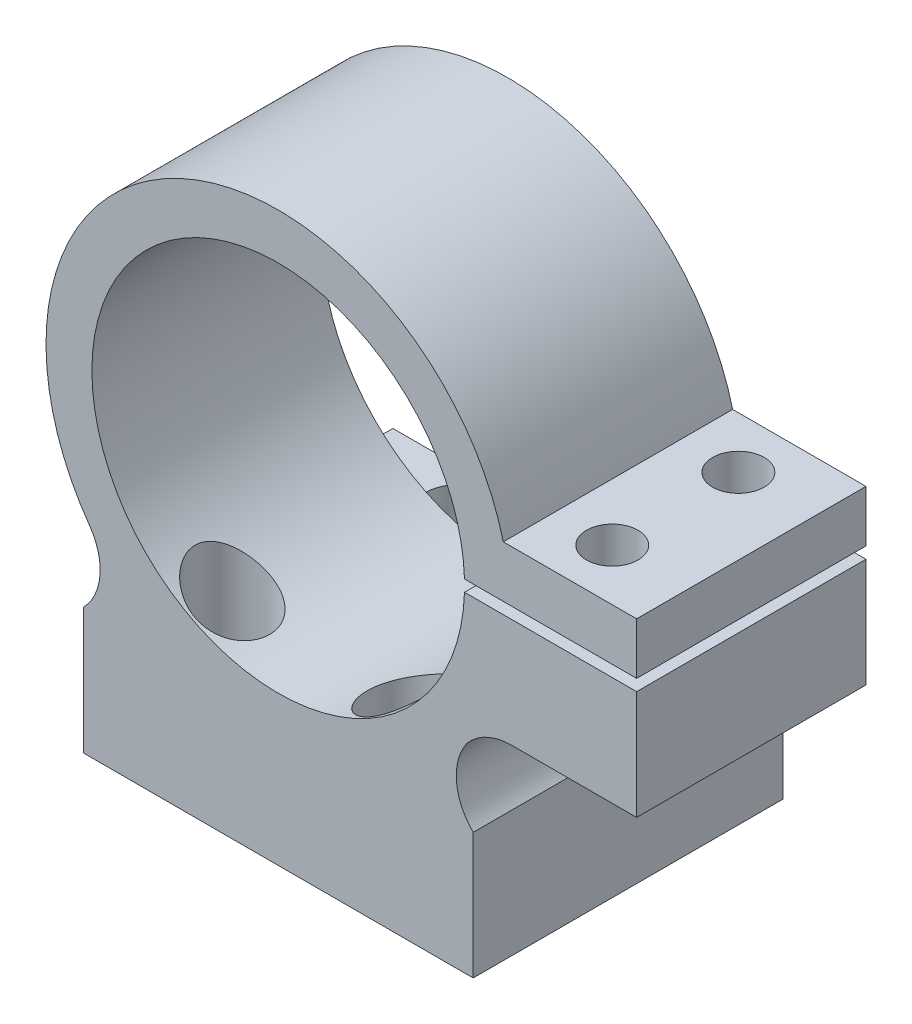
from build123d import *

# Parameters (mm, degrees)
SKETCH1_W                     = 34
SKETCH1_H                     = 27
BOSS_EXTRUDE1_DEPTH           = 11
SKETCH2_R                     = 20.25
SKETCH2_R_2                   = 16.25
MOTOR_CLAMP_BAND_DEPTH        = 20
FILLET4_R                     = 5
SKETCH7_W                     = 15
SKETCH7_H                     = 15
BOSS_EXTRUDE3_DEPTH           = 20
FILLET5_R                     = 5
CBORE_FOR_M3_SHCS1_AT_2_COUNT = 2
CBORE_FOR_M3_SHCS1_AT_2_PITCH = 15
CBORE_FOR_M3_SHCS1_AT_3_COUNT = 2
CBORE_FOR_M3_SHCS1_AT_3_PITCH = 25
CBORE_FOR_M3_SHCS1_AT_4_COUNT = 2
CBORE_FOR_M3_SHCS1_AT_4_PITCH = 20
EXTENDED_START                = 15
SKETCH6_R                     = 3.25
EXTENDED_COUNTERBORE_1_DEPTH  = 15
M4_CLEARANCE_HOLE1_D          = 4.5
CUT_EXTRUDE2_DEPTH            = 3
SKETCH14_W                    = 15.007694129
SKETCH14_H                    = 1
CUT_EXTRUDE3_DEPTH            = 65.465591597
FILLET3_R                     = 5


with BuildPart() as part:
    # Sketch1 → Boss-Extrude1 (new body)
    with BuildSketch(Plane(origin=(0, 0, 0), x_dir=(1, 0, 0), z_dir=(0, 1, 0))):
        Rectangle(SKETCH1_W, SKETCH1_H)
    extrude(amount=BOSS_EXTRUDE1_DEPTH)

    # Sketch2 → Motor Clamp Band (add)
    with BuildSketch(Plane.XY.offset(13.5)):
        with Locations((0, 29.25)):
            Circle(SKETCH2_R)
        with Locations((0, 29.25)):
            Circle(SKETCH2_R_2, mode=Mode.SUBTRACT)
    extrude(amount=-MOTOR_CLAMP_BAND_DEPTH)

    # Fillet4
    # the kernel refuses this fillet: 5 mm, written as the material it adds along each edge
    with BuildSketch(Plane(origin=(8.774964387, 11, -6.5), x_dir=(0.7657018852259857, 0.6431956335061453, 0), z_dir=(0, 0, 1))) as fillet4_piece_1:
        with BuildLine():
            CenterArc((11.27796375, -4.843969922), FILLET4_R, 104.351347878, 80.770115484)
            Line((6.297925275, -5.290306991), (6.198324505, -5.299233733))
            ThreePointArc((6.198324505, -5.299233733), (3.084643074, -2.721723684), (-0.064319563, -0.076570189))
            Line((-0.064319563, -0.076570189), (0.024786734, 0.096879398))
            ThreePointArc((0.024786734, 0.096879398), (5.019313537, -0.531921816), (10.013840341, 0.096879398))
            Line((10.013840341, 0.096879398), (10.038627075, 0))
        make_face()
    extrude(amount=20)

    # Sketch7 → Boss-Extrude3 (add)
    with BuildSketch(Plane.XY.offset(13.5)):
        with Locations((23.75, 26.75)):
            Rectangle(SKETCH7_W, SKETCH7_H)
    extrude(amount=-BOSS_EXTRUDE3_DEPTH)

    # Fillet5
    # the kernel refuses this fillet: 5 mm, written as the material it adds along each edge
    with BuildSketch(Plane(origin=(-8.774964387, 11, -6.5), x_dir=(-1, 0, 0), z_dir=(0, 0, 1))) as fillet5_piece_1:
        with BuildLine():
            CenterArc((11.751178408, -3.544900138), FILLET5_R, 134.848011946, 80.770115484)
            Line((7.686595676, -6.456801101), (7.605304021, -6.51503912))
            ThreePointArc((7.605304021, -6.51503912), (4.185427628, -2.821107013), (-0.043333157, -0.090123457))
            Line((-0.043333157, -0.090123457), (0, 0.1))
            ThreePointArc((0, 0.1), (4.112517806, 0.1), (8.154512757, 0.070898003))
            Line((8.154512757, 0.070898003), (8.225035613, 0))
        make_face()
    extrude(amount=20)

    # Sketch4 → CBORE for M3 SHCS1 (revolve, cut)
    with BuildSketch(Plane(origin=(7.5, 11, -10), x_dir=(0, 0, 1), z_dir=(1, 0, 0))):
        Polygon((0, 0), (0, 11), (1.7, 11), (1.7, 3), (3.25, 3), (3.25, 0), align=None)
    cbore_for_m3_shcs1 = revolve(axis=Axis((7.5, 17.35, -10), (0, -1, 0)), mode=Mode.SUBTRACT)

    # CBORE for M3 SHCS1 at 2: CBORE for M3 SHCS1 ×2
    with Locations(*[(-i * CBORE_FOR_M3_SHCS1_AT_2_PITCH, 0, 0) for i in range(1, CBORE_FOR_M3_SHCS1_AT_2_COUNT)]):
        add(cbore_for_m3_shcs1, mode=Mode.SUBTRACT)

    # CBORE for M3 SHCS1 at 3: CBORE for M3 SHCS1 ×2
    with Locations(*[Vector(-0.5999999999999989, 0, 0.8000000000000009) * (i * CBORE_FOR_M3_SHCS1_AT_3_PITCH) for i in range(1, CBORE_FOR_M3_SHCS1_AT_3_COUNT)]):
        add(cbore_for_m3_shcs1, mode=Mode.SUBTRACT)

    # CBORE for M3 SHCS1 at 4: CBORE for M3 SHCS1 ×2
    with Locations(*[(0, 0, i * CBORE_FOR_M3_SHCS1_AT_4_PITCH) for i in range(1, CBORE_FOR_M3_SHCS1_AT_4_COUNT)]):
        add(cbore_for_m3_shcs1, mode=Mode.SUBTRACT)

    # Sketch6 → Extended CounterBore 1 (cut)
    with BuildSketch(Plane(origin=(0, 11, 0), x_dir=(1, 0, 0), z_dir=(0, 1, 0)).offset(EXTENDED_START)):
        with Locations(Location((7.5, -10, 0), (0, 0, 270))):
            Circle(SKETCH6_R)
        with Locations(Location((-7.5, -10, 0), (0, 0, 270))):
            Circle(SKETCH6_R)
    extrude(amount=-EXTENDED_COUNTERBORE_1_DEPTH, mode=Mode.SUBTRACT)

    # M4 Clearance Hole1 (through all)
    with Locations(Plane(origin=(0, 34.25, 0), x_dir=(-1, 0, 0), z_dir=(0, 1, 0))):
        with Locations((-24.623009453, -2), (-24.623009453, 9)):
            Hole(M4_CLEARANCE_HOLE1_D / 2)

    # Sketch13 → Cut-Extrude2 (cut)
    with BuildSketch(Plane.XZ.offset(-19.25)):
        Polygon((24.623009453, 12.954849344), (21.198009453, 10.977424672), (21.198009453, 7.022575328), (24.623009453, 5.045150656), (28.048009453, 7.022575328), (28.048009453, 10.977424672), align=None)
        Polygon((28.048009453, -0.022575328), (24.623009453, 1.954849344), (21.198009453, -0.022575328), (21.198009453, -3.977424672), (24.623009453, -5.954849344), (28.048009453, -3.977424672), align=None)
    extrude(amount=-CUT_EXTRUDE2_DEPTH, mode=Mode.SUBTRACT)

    # Sketch14 → Cut-Extrude3 (cut, through all)
    with BuildSketch(Plane.XY.offset(13.5)):
        with Locations((23.746152936, 29.25)):
            Rectangle(SKETCH14_W, SKETCH14_H)
    extrude(amount=-CUT_EXTRUDE3_DEPTH, mode=Mode.SUBTRACT)

    # Fillet3
    # the kernel refuses this fillet: 5 mm, written as the material it adds along each edge
    with BuildSketch(Plane(origin=(17.608591653, 19.25, -6.5), x_dir=(-0.5388484844645524, -0.8424027010820033, 0), z_dir=(0, 0, 1))) as fillet3_piece_1:
        with BuildLine():
            CenterArc((2.762959446, 4.959604744), FILLET3_R, 212.605284551, 50.106677373)
            Line((-1.44905406, 2.265362322), (-1.53329433, 2.211477474))
            Line((-1.53329433, 2.211477474), (-0.08424027, -0.053884848))
            Line((-0.08424027, -0.053884848), (0.00525598, -0.099861778))
            ThreePointArc((0.00525598, -0.099861778), (1.064335915, -0.072010015), (2.115986078, -0.099192095))
            Line((2.115986078, -0.099192095), (2.12867183, 0))
        make_face()
    extrude(amount=20)


solid = part.part
